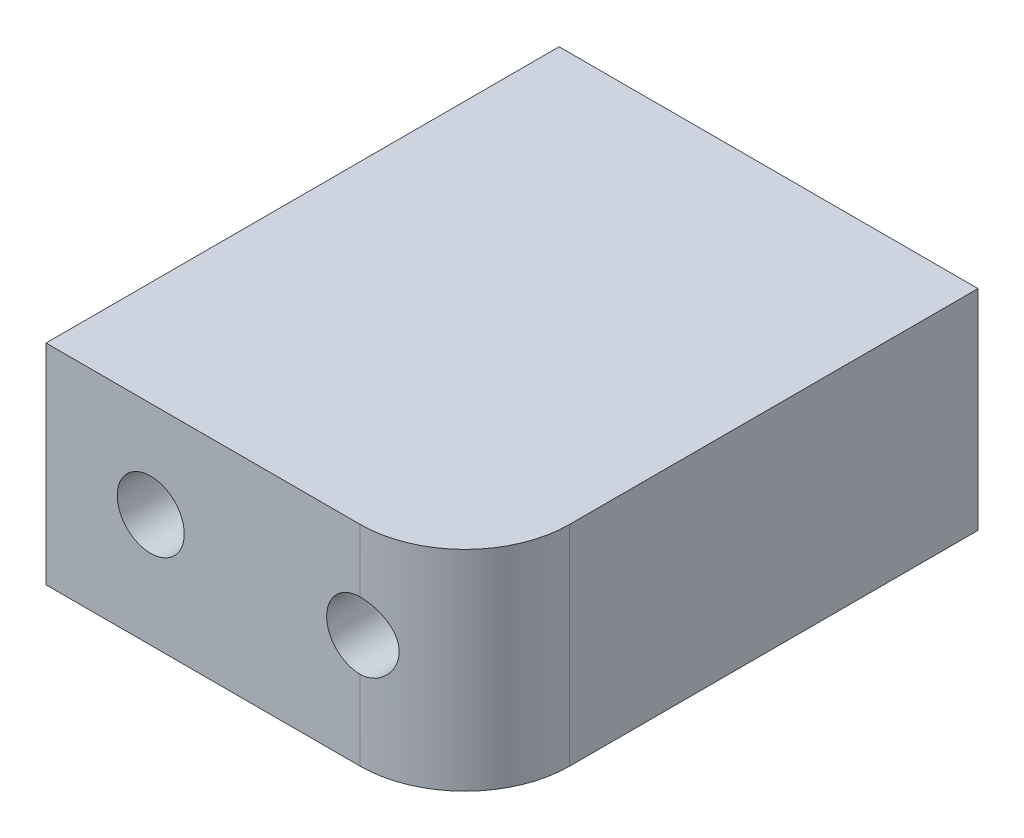
from build123d import *

# Parameters (mm, degrees)
SKETCH_1_W      = 20
SKETCH_1_H      = 10
SKETCH_1_R      = 1.6
EXTRUDE_1_DEPTH = 24.5
FILLET_1_R      = 5


with BuildPart() as part:
    # ｽｹｯﾁ1 → ﾎﾞｽ - 押し出し1 (new body)
    with BuildSketch(Plane.XY):
        Rectangle(SKETCH_1_W, SKETCH_1_H)
        with Locations((-5, 0.4)):
            Circle(SKETCH_1_R, mode=Mode.SUBTRACT)
        with Locations(Location((5, 0.4, 0), (0, 0, 180))):
            Circle(SKETCH_1_R, mode=Mode.SUBTRACT)
    extrude(amount=EXTRUDE_1_DEPTH)

    # ﾌｨﾚｯﾄ1
    # the kernel refuses this fillet: 5 mm, written as the material it takes off along each edge
    with BuildSketch(Plane(origin=(10, 17.5, 24.5), x_dir=(0, 0, -1), z_dir=(0, -1, 0))) as fillet_1_piece_1:
        with BuildLine():
            CenterArc((FILLET_1_R, -FILLET_1_R), FILLET_1_R, 90, 90)
            Line((0, -FILLET_1_R), (0, 0))
            Line((0, 0), (FILLET_1_R, 0))
        make_face()
    extrude(amount=35, mode=Mode.SUBTRACT)


solid = part.part
